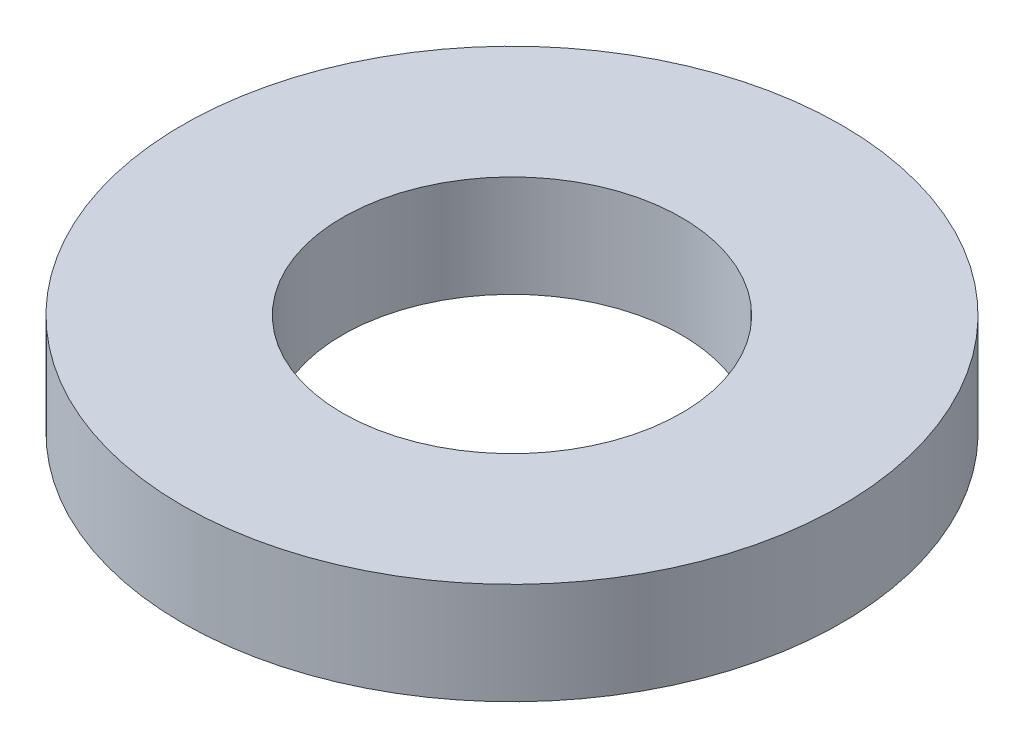
from build123d import *

# Parameters (mm, degrees)
SKETCH1_R           = 87.5
BOSS_EXTRUDE1_DEPTH = 27
SKETCH2_R           = 45
CUT_EXTRUDE1_DEPTH  = 127.655043326


with BuildPart() as part:
    # Sketch1 → Boss-Extrude1 (new body)
    with BuildSketch(Plane(origin=(0, 0, 0), x_dir=(1, 0, 0), z_dir=(0, 1, 0))):
        Circle(SKETCH1_R)
    extrude(amount=BOSS_EXTRUDE1_DEPTH)

    # Sketch2 → Cut-Extrude1 (cut, through all)
    with BuildSketch(Plane(origin=(0, 0, 0), x_dir=(1, 0, 0), z_dir=(0, 1, 0))):
        Circle(SKETCH2_R)
    extrude(amount=CUT_EXTRUDE1_DEPTH, mode=Mode.SUBTRACT)


solid = part.part
